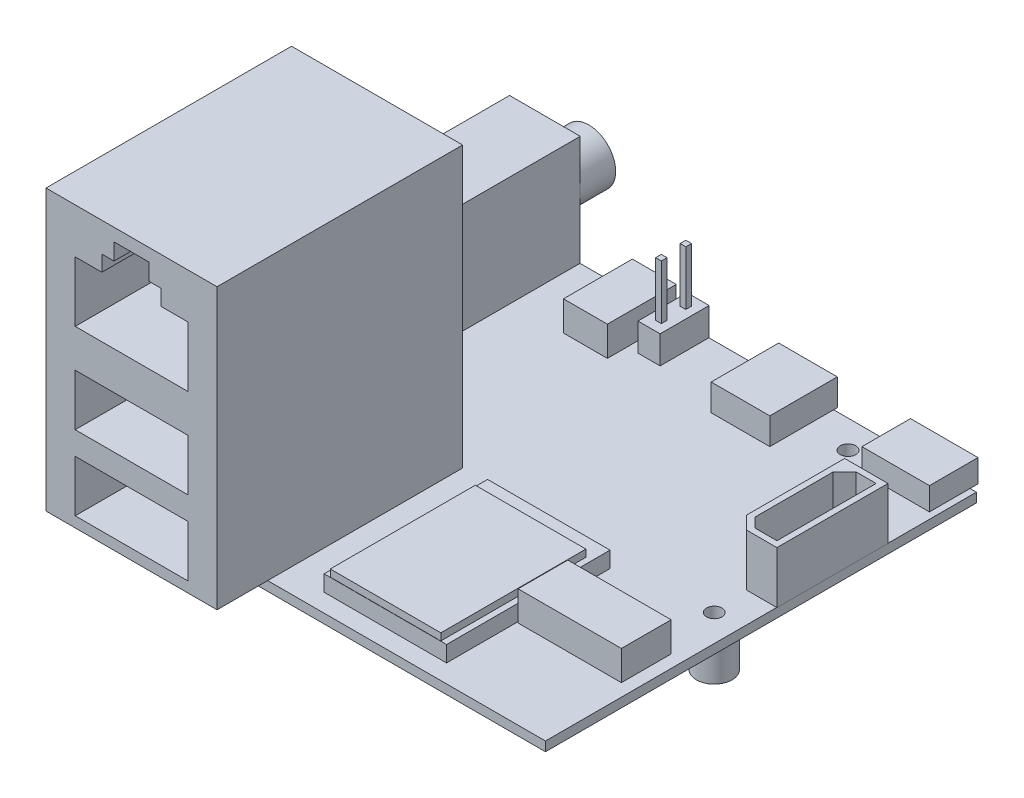
from build123d import *

# Parameters (mm, degrees)
SKETCH1_W                   = 52
SKETCH1_H                   = 48
BASE_DEPTH                  = 1.04
SKETCH3_W                   = 19.05
SKETCH3_H                   = 27.35
ETHERNET_USB_LINKPP_DEPTH   = 31.1658
SKETCH4_W                   = 12.5476
SKETCH4_H                   = 5.7404
USB_PORTS_DEPTH             = 8.89
ETHERNET_PORT_DEPTH         = 11.4681
SKETCH6_W                   = 7.874
SKETCH6_H                   = 13.97
HEADPHONE_JACK_DEPTH        = 12.2428
SKETCH7_R                   = 2.9972
SKETCH7_R_2                 = 1.7653
HEADPHONE_JACK_CIRCLE_DEPTH = 3.9751
SKETCH8_W                   = 4.8895
SKETCH8_H                   = 7.6708
DC_POWER_DEPTH              = 3.302
SKETCH9_R                   = 1.25
DC_POWER_HOLE_DEPTH         = 5.842
SKETCH10_R                  = 0.4
DC_POWER_PIN_DEPTH          = 4.1656
SKETCH11_W                  = 2.4638
SKETCH11_H                  = 5.461
PWM_PIN_BASE_DEPTH          = 3.0988
SKETCH12_W                  = 0.635
SKETCH12_H                  = 0.635
PWM_PINS_DEPTH              = 6.0452
SKETCH13_W                  = 6.5278
SKETCH13_H                  = 7.5184
MICRO_HDMI_PORT_DEPTH       = 2.9718
SKETCH14_W                  = 7.5184
SKETCH14_H                  = 5.4102
MICRO_USB_PORT_DEPTH        = 2.54
HEADER_HOLE_REACH           = 82.266
SKETCH15_R                  = 0.8636
SKETCH16_R                  = 1.9939
STANDOFFS_1_DEPTH           = 4.4704
SKETCH17_R                  = 1.9939
SHORT_STANDOFF_DEPTH        = 1.9939
THREADS_IN_STANDOFFS_REACH  = 82.266
SKETCH19_R                  = 0.8636
SKETCH20_W                  = 12.1158
SKETCH20_H                  = 12.1158
CPU_DEPTH                   = 1.4732
UART_PLASTIC_DEPTH          = 5.7912
UART_HOLE_DEPTH             = 4.1656
SKETCH23_W                  = 11.5062
SKETCH23_H                  = 5.5372
MICROSD_DEPTH               = 3.302
SKETCH24_W                  = 13.6398
SKETCH24_H                  = 18.2118
EMMC_BOARD_DEPTH            = 1.778
SKETCH25_W                  = 12.319
SKETCH25_H                  = 16.1544
EMMC_CHIP_DEPTH             = 0.7874


with BuildPart() as part:
    # Sketch1 → Base (new body)
    with BuildSketch(Plane(origin=(0, 0, 0), x_dir=(1, 0, 0), z_dir=(0, 1, 0))):
        with Locations((26, 24)):
            Rectangle(SKETCH1_W, SKETCH1_H)
    extrude(amount=BASE_DEPTH)

    # Sketch3 → Ethernet-USB-LinkPP (add)
    with BuildSketch(Plane(origin=(0, 1.04, 0), x_dir=(1, 0, 0), z_dir=(0, 1, 0))):
        with Locations((11.5316, 8.0362)):
            Rectangle(SKETCH3_W, SKETCH3_H)
    extrude(amount=ETHERNET_USB_LINKPP_DEPTH)

    # Sketch4 → USB ports (cut)
    with BuildSketch(Plane.XY.offset(5.6388)):
        with Locations((11.5316, 5.0786)):
            Rectangle(SKETCH4_W, SKETCH4_H)
        with Locations((11.5316, 13.3844)):
            Rectangle(SKETCH4_W, SKETCH4_H)
    extrude(amount=-USB_PORTS_DEPTH, mode=Mode.SUBTRACT)

    # Sketch5 → Ethernet port (cut)
    with BuildSketch(Plane.XY.offset(5.6388)):
        Polygon((5.2578, 27.1893), (8.2296, 27.1893), (8.2296, 28.9419), (9.5758, 28.9419), (9.5758, 30.7961), (13.4874, 30.7961), (13.4874, 28.9419), (14.8336, 28.9419), (14.8336, 27.1893), (17.8054, 27.1893), (17.8054, 20.4837), (5.2578, 20.4837), align=None)
    extrude(amount=-ETHERNET_PORT_DEPTH, mode=Mode.SUBTRACT)

    # Sketch6 → Headphone jack (add)
    with BuildSketch(Plane(origin=(0, 1.04, 0), x_dir=(1, 0, 0), z_dir=(0, 1, 0))):
        with Locations((3.9116, 41.0404)):
            Rectangle(SKETCH6_W, SKETCH6_H)
    extrude(amount=HEADPHONE_JACK_DEPTH)

    # Sketch7 → Headphone jack circle (add)
    with BuildSketch(Plane(origin=(0, 0, -48), x_dir=(-1, 0, 0), z_dir=(0, 0, -1))):
        with Locations((-4.8514, 7.9107)):
            Circle(SKETCH7_R)
        with Locations((-4.8514, 7.9107)):
            Circle(SKETCH7_R_2, mode=Mode.SUBTRACT)
    extrude(amount=HEADPHONE_JACK_CIRCLE_DEPTH)

    # Sketch8 → DC power (add)
    with BuildSketch(Plane(origin=(0, 1.04, 0), x_dir=(1, 0, 0), z_dir=(0, 1, 0))):
        with Locations((16.09725, 44.19)):
            Rectangle(SKETCH8_W, SKETCH8_H)
    extrude(amount=DC_POWER_DEPTH)

    # Sketch9 → DC power hole (cut)
    with BuildSketch(Plane(origin=(0, 0, -48.0254), x_dir=(-1, 0, 0), z_dir=(0, 0, -1))):
        with Locations((-16.09725, 2.3154)):
            Circle(SKETCH9_R)
    extrude(amount=-DC_POWER_HOLE_DEPTH, mode=Mode.SUBTRACT)

    # Sketch10 → DC power pin (add)
    with BuildSketch(Plane(origin=(0, 0, -42.1834), x_dir=(-1, 0, 0), z_dir=(0, 0, -1))):
        with Locations((-16.09725, 2.3154)):
            Circle(SKETCH10_R)
    extrude(amount=DC_POWER_PIN_DEPTH)

    # Sketch11 → PWM pin base (add)
    with BuildSketch(Plane(origin=(0, 1.04, 0), x_dir=(1, 0, 0), z_dir=(0, 1, 0))):
        with Locations((20.9739, 45.2949)):
            Rectangle(SKETCH11_W, SKETCH11_H)
    extrude(amount=PWM_PIN_BASE_DEPTH)

    # Sketch12 → PWM pins (add)
    with BuildSketch(Plane(origin=(0, 4.1388, 0), x_dir=(1, 0, 0), z_dir=(0, 1, 0))):
        with Locations((20.9739, 43.92965)):
            Rectangle(SKETCH12_W, SKETCH12_H)
        with Locations((20.9739, 46.66015)):
            Rectangle(SKETCH12_W, SKETCH12_H)
    extrude(amount=PWM_PINS_DEPTH)

    # Sketch13 → Micro HDMI port (add)
    with BuildSketch(Plane(origin=(0, 1.04, 0), x_dir=(1, 0, 0), z_dir=(0, 1, 0))):
        with Locations((32.8357, 44.6472)):
            Rectangle(SKETCH13_W, SKETCH13_H)
    extrude(amount=MICRO_HDMI_PORT_DEPTH)

    # Sketch14 → Micro USB port (add)
    with BuildSketch(Plane(origin=(0, 1.04, 0), x_dir=(1, 0, 0), z_dir=(0, 1, 0))):
        with Locations((47.5296, 46.1839)):
            Rectangle(SKETCH14_W, SKETCH14_H)
    extrude(amount=MICRO_USB_PORT_DEPTH)

    # Sketch15 → Header hole (cut, up to next)
    with BuildSketch(Plane(origin=(0, 0, 0), x_dir=(-1, 0, 0), z_dir=(0, -1, 0)), mode=Mode.PRIVATE) as header_hole_sk1:
        with Locations((-3, 30.1)):
            Circle(SKETCH15_R)
    header_hole_tool1 = extrude(header_hole_sk1.sketch, amount=-HEADER_HOLE_REACH, mode=Mode.PRIVATE) & part.part
    # Sketch15 → Header hole (cut, up to next)
    with BuildSketch(Plane(origin=(0, 0, 0), x_dir=(-1, 0, 0), z_dir=(0, -1, 0)), mode=Mode.PRIVATE) as header_hole_sk2:
        with Locations((-49, 21.8012)):
            Circle(SKETCH15_R)
    header_hole_tool2 = extrude(header_hole_sk2.sketch, amount=-HEADER_HOLE_REACH, mode=Mode.PRIVATE) & part.part
    # Sketch15 → Header hole (cut, up to next)
    with BuildSketch(Plane(origin=(0, 0, 0), x_dir=(-1, 0, 0), z_dir=(0, -1, 0)), mode=Mode.PRIVATE) as header_hole_sk3:
        with Locations((-40.8, 44.9012)):
            Circle(SKETCH15_R)
    header_hole_tool3 = extrude(header_hole_sk3.sketch, amount=-HEADER_HOLE_REACH, mode=Mode.PRIVATE) & part.part
    add(header_hole_tool1.solids().sort_by_distance((3, 0, -30.1))[0], mode=Mode.SUBTRACT)
    add(header_hole_tool2.solids().sort_by_distance((49, 0, -21.8012))[0], mode=Mode.SUBTRACT)
    add(header_hole_tool3.solids().sort_by_distance((40.8, 0, -44.9012))[0], mode=Mode.SUBTRACT)

    # Sketch16 → Standoffs 1 (add)
    with BuildSketch(Plane.XZ):
        with Locations((49, -21.8012)):
            Circle(SKETCH16_R)
        with Locations((3, -30.1)):
            Circle(SKETCH16_R)
    extrude(amount=STANDOFFS_1_DEPTH)

    # Sketch17 → Short standoff (add)
    with BuildSketch(Plane.XZ):
        with Locations((40.8, -44.9012)):
            Circle(SKETCH17_R)
    extrude(amount=SHORT_STANDOFF_DEPTH)

    # Sketch19 → Threads in standoffs (cut, up to next)
    with BuildSketch(Plane.XZ, mode=Mode.PRIVATE) as threads_in_standoffs_sk1:
        with Locations((40.8, -44.9012)):
            Circle(SKETCH19_R)
    threads_in_standoffs_tool1 = extrude(threads_in_standoffs_sk1.sketch, amount=THREADS_IN_STANDOFFS_REACH, mode=Mode.PRIVATE) & part.part
    # Sketch19 → Threads in standoffs (cut, up to next)
    with BuildSketch(Plane.XZ, mode=Mode.PRIVATE) as threads_in_standoffs_sk2:
        with Locations((49, -21.8012)):
            Circle(SKETCH19_R)
    threads_in_standoffs_tool2 = extrude(threads_in_standoffs_sk2.sketch, amount=THREADS_IN_STANDOFFS_REACH, mode=Mode.PRIVATE) & part.part
    # Sketch19 → Threads in standoffs (cut, up to next)
    with BuildSketch(Plane.XZ, mode=Mode.PRIVATE) as threads_in_standoffs_sk3:
        with Locations((3, -30.1)):
            Circle(SKETCH19_R)
    threads_in_standoffs_tool3 = extrude(threads_in_standoffs_sk3.sketch, amount=THREADS_IN_STANDOFFS_REACH, mode=Mode.PRIVATE) & part.part
    add(threads_in_standoffs_tool1.solids().sort_by_distance((40.8, 0, -44.9012))[0], mode=Mode.SUBTRACT)
    add(threads_in_standoffs_tool2.solids().sort_by_distance((49, 0, -21.8012))[0], mode=Mode.SUBTRACT)
    add(threads_in_standoffs_tool3.solids().sort_by_distance((3, 0, -30.1))[0], mode=Mode.SUBTRACT)

    # Sketch20 → CPU (add)
    with BuildSketch(Plane(origin=(0, 0, 0), x_dir=(-1, 0, 0), z_dir=(0, -1, 0))):
        with Locations((-37.8141, 31.1979)):
            Rectangle(SKETCH20_W, SKETCH20_H)
    extrude(amount=CPU_DEPTH)

    # Sketch21 → UART plastic (add)
    with BuildSketch(Plane(origin=(0, 1.04, 0), x_dir=(1, 0, 0), z_dir=(0, 1, 0))):
        Polygon((52.0254, 38.1254), (47.1994, 38.1254), (47.1994, 27.192440979), (48.636240979, 25.7556), (52.0254, 25.7556), align=None)
    extrude(amount=UART_PLASTIC_DEPTH)

    # Sketch22 → UART hole (cut)
    with BuildSketch(Plane(origin=(0, 6.8312, 0), x_dir=(1, 0, 0), z_dir=(0, 1, 0))):
        Polygon((51.365, 37.465), (49.134996369, 37.465), (47.8598, 36.189803631), (47.8598, 27.465987616), (48.909787616, 26.416), (51.365, 26.416), align=None)
    extrude(amount=-UART_HOLE_DEPTH, mode=Mode.SUBTRACT)

    # Sketch23 → MicroSD (add)
    with BuildSketch(Plane(origin=(0, 1.04, 0), x_dir=(1, 0, 0), z_dir=(0, 1, 0))):
        with Locations((44.8499, 12.6238)):
            Rectangle(SKETCH23_W, SKETCH23_H)
    extrude(amount=MICROSD_DEPTH)

    # Sketch24 → eMMC board (add)
    with BuildSketch(Plane(origin=(0, 1.04, 0), x_dir=(1, 0, 0), z_dir=(0, 1, 0))):
        with Locations((32.1437, 11.1252)):
            Rectangle(SKETCH24_W, SKETCH24_H)
    extrude(amount=EMMC_BOARD_DEPTH)

    # Sketch25 → eMMC chip (add)
    with BuildSketch(Plane(origin=(0, 2.818, 0), x_dir=(1, 0, 0), z_dir=(0, 1, 0))):
        with Locations((32.1437, 10.1219)):
            Rectangle(SKETCH25_W, SKETCH25_H)
    extrude(amount=EMMC_CHIP_DEPTH)


solid = part.part
